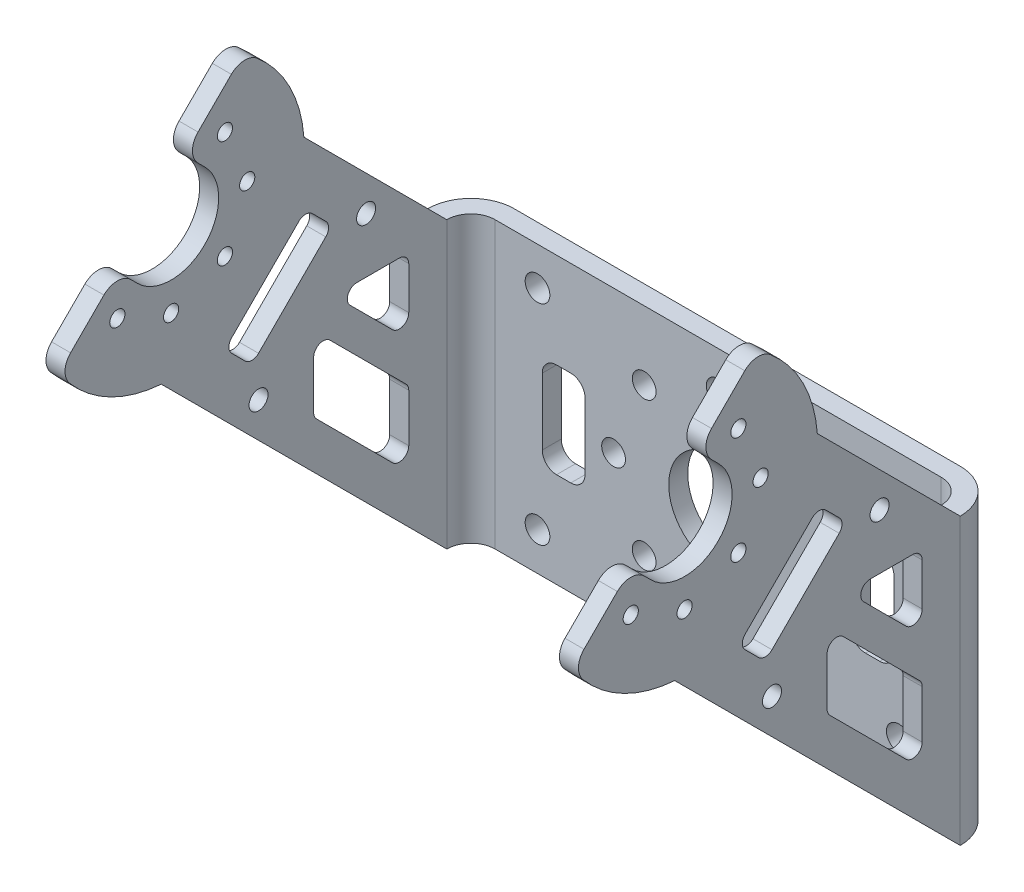
from build123d import *

# Parameters (mm, degrees)
KES_EKSTR_ZYON1_START          = -54
KES_EKSTR_ZYON1_OUTLINE_W      = 2
KES_EKSTR_ZYON1_OUTLINE_H      = 30
KES_EKSTR_ZYON1_DEPTH          = 56
KES_EKSTR_ZYON1_2_DEPTH        = 2
KES_EKSTR_ZYON1_3_DEPTH        = 2
KES_EKSTR_ZYON2_DEPTH          = 82.444892691
KES_EKSTR_ZYON3_DEPTH          = 82.444892691
KES_EKSTR_ZYON4_REACH          = 69.092
IZIM4_W                        = 4.5
IZIM4_H                        = 10
KES_EKSTR_ZYON5_DEPTH          = 82.444892691
KES_EKSTR_ZYON6_DEPTH          = 82.444892691
KES_EKSTR_ZYON7_DEPTH          = 82.444892691
KES_EKSTR_ZYON8_DEPTH          = 82.444892691
KES_EKSTR_ZYON9_DEPTH          = 82.444892691
KES_EKSTR_ZYON10_DEPTH         = 82.444892691
IZIM11_W                       = 4.5
IZIM11_H                       = 10
KES_EKSTR_ZYON11_DEPTH         = 66.75699783
DELIK1_D                       = 2.6
DELIK2_D                       = 10.4
F_0_2_0_2_DIAMETER_HOLE1_D     = 2
F_0_2_0_2_DIAMETER_HOLE1_DEPTH = 2
F_0_2_0_2_DIAMETER_HOLE2_D     = 2
RADYUS1_R                      = 1
RADYUS2_R                      = 1.5
RADYUS3_R                      = 2
RADYUS4_R                      = 2.54
RADYUS5_R                      = 4.54
IZIM24_R                       = 13.505605706
IZIM24_R_2                     = 7.578470051
Y_KSEKLIK_EKSTR_ZYON1_DEPTH    = 2
IZIM25_R                       = 1.25
KES_EKSTR_ZYON12_DEPTH         = 2
KES_EKSTR_ZYON13_REACH         = 84.134
IZIM27_R                       = 0.8


with BuildPart() as part:
    # Kes-Ekstrüzyon1: read off the stored shape, not the designer's step
    # Kes-Ekstrüzyon1 outline → Kes-Ekstrüzyon1 (new body)
    with BuildSketch(Plane(origin=(26, 0, 0), x_dir=(0, 0, -1), z_dir=(1, 0, 0)).offset(KES_EKSTR_ZYON1_START)):
        with Locations((-1, 0)):
            Rectangle(KES_EKSTR_ZYON1_OUTLINE_W, KES_EKSTR_ZYON1_OUTLINE_H)
    extrude(amount=KES_EKSTR_ZYON1_DEPTH)

    # Kes-Ekstr_zyon1 2 outline → Kes-Ekstr_zyon1 2 (add)
    with BuildSketch(Plane(origin=(26, 0, 0), x_dir=(0, 0, -1), z_dir=(1, 0, 0)).offset(KES_EKSTR_ZYON1_START)):
        with BuildLine():
            Line((-4.54, 15), (-19.569954037, 30.029954037))
            ThreePointArc((-19.569954037, 30.029954037), (-21.507688424, 36.162918334), (-25.983160829, 40.78224863))
            Line((-25.983160829, 40.78224863), (-45.321945481, 21.443463382))
            ThreePointArc((-45.321945481, 21.443463382), (-40.702951136, 16.968195195), (-34.570405924, 15.030406939))
            Line((-34.570405924, 15.030406939), (-4.54, -15))
            Line((-4.54, -15), (-2, -15))
            Line((-2, -15), (-2, 15))
            Line((-2, 15), (-4.54, 15))
        make_face()
    extrude(amount=KES_EKSTR_ZYON1_2_DEPTH)

    # Kes-Ekstr_zyon1 3 outline → Kes-Ekstr_zyon1 3 (add)
    with BuildSketch(Plane(origin=(26, 0, 0), x_dir=(0, 0, -1), z_dir=(1, 0, 0))):
        with BuildLine():
            Line((-4.54, 15), (-19.569954037, 30.029954037))
            ThreePointArc((-19.569954037, 30.029954037), (-21.507688424, 36.162918334), (-25.983160829, 40.78224863))
            Line((-25.983160829, 40.78224863), (-45.321945481, 21.443463382))
            ThreePointArc((-45.321945481, 21.443463382), (-40.702951136, 16.968195195), (-34.570405924, 15.030406939))
            Line((-34.570405924, 15.030406939), (-4.54, -15))
            Line((-4.54, -15), (-2, -15))
            Line((-2, -15), (-2, 15))
            Line((-2, 15), (-4.54, 15))
        make_face()
    extrude(amount=KES_EKSTR_ZYON1_3_DEPTH)

    # Çizim2 → Kes-Ekstrüzyon2 (cut, through all)
    with BuildSketch(Plane.ZY.offset(-26)):
        with BuildLine():
            Line((39.188241686, 27.577167772), (32.117166758, 34.648242701))
            Line((32.117166758, 34.648242701), (29.995846117, 32.52692206))
            ThreePointArc((29.995846117, 32.52692206), (29.995846117, 25.455847131), (37.066921045, 25.455847131))
            Line((37.066921045, 25.455847131), (39.188241686, 27.577167772))
        make_face()
    extrude(amount=-KES_EKSTR_ZYON2_DEPTH, mode=Mode.SUBTRACT)

    # Çizim3 → Kes-Ekstrüzyon3 (cut, through all)
    with BuildSketch(Plane(origin=(-26, 0, 0), x_dir=(0, 0, -1), z_dir=(1, 0, 0))):
        with BuildLine():
            Line((-32.11716646, 34.648242403), (-39.188241389, 27.577167475))
            Line((-39.188241389, 27.577167475), (-37.066921045, 25.455847131))
            ThreePointArc((-37.066921045, 25.455847131), (-29.995846117, 25.455847131), (-29.995846117, 32.52692206))
            Line((-29.995846117, 32.52692206), (-32.11716646, 34.648242403))
        make_face()
    extrude(amount=-KES_EKSTR_ZYON3_DEPTH, mode=Mode.SUBTRACT)

    # Çizim4 → Kes-Ekstrüzyon4 (cut, up to next)
    with BuildSketch(Plane(origin=(0, 0, 0), x_dir=(-1, 0, 0), z_dir=(0, 0, -1)), mode=Mode.PRIVATE) as kes_ekstr_zyon4_sk1:
        with Locations((16.25, 0)):
            Rectangle(IZIM4_W, IZIM4_H)
    kes_ekstr_zyon4_tool1 = extrude(kes_ekstr_zyon4_sk1.sketch, amount=-KES_EKSTR_ZYON4_REACH, mode=Mode.PRIVATE) & part.part
    add(kes_ekstr_zyon4_tool1.solids().sort_by_distance((-16.25, 0, 0))[0], mode=Mode.SUBTRACT)

    # Çizim5 → Kes-Ekstrüzyon5 (cut, through all)
    with BuildSketch(Plane.ZY.offset(-26)):
        with BuildLine():
            Line((10.247106781, 7.828427125), (14.711572875, 12.292893219))
            ThreePointArc((14.711572875, 12.292893219), (14.928345627, 13.382683432), (14.004466094, 14))
            Line((14.004466094, 14), (8.54, 14))
            Line((8.54, 14), (8.54, 8.535533906))
            ThreePointArc((8.54, 8.535533906), (9.157316568, 7.611654373), (10.247106781, 7.828427125))
        make_face()
    extrude(amount=-KES_EKSTR_ZYON5_DEPTH, mode=Mode.SUBTRACT)

    # Çizim6 → Kes-Ekstrüzyon6 (cut, through all)
    with BuildSketch(Plane.ZY.offset(-26)):
        Polygon((27.874529335, 14.849248859), (19.389247817, 23.334530089), (16.56082074, 20.506102917), (25.046102258, 12.020821686), align=None)
    extrude(amount=-KES_EKSTR_ZYON6_DEPTH, mode=Mode.SUBTRACT)

    # Çizim7 → Kes-Ekstrüzyon7 (cut, through all)
    with BuildSketch(Plane.ZY.offset(-26)):
        with BuildLine():
            Line((16.832893122, 10.171572778), (8.54, 1.878679656))
            Line((8.54, 1.878679656), (8.54, -3.585786438))
            ThreePointArc((8.54, -3.585786438), (9.157316575, -4.509665973), (10.247106793, -4.292893207))
            Line((10.247106793, -4.292893207), (18.539999854, 4.000000134))
            Line((18.539999854, 4.000000134), (18.539999854, 9.464466017))
            ThreePointArc((18.539999854, 9.464466017), (17.922683304, 10.388345523), (16.832893122, 10.171572778))
        make_face()
    extrude(amount=-KES_EKSTR_ZYON7_DEPTH, mode=Mode.SUBTRACT)

    # Çizim8 → Kes-Ekstrüzyon8 (cut, through all)
    with BuildSketch(Plane(origin=(-26, 0, 0), x_dir=(0, 0, -1), z_dir=(1, 0, 0))):
        with BuildLine():
            Line((-8.54, 8.535533906), (-8.54, 14))
            Line((-8.54, 14), (-14.004466094, 14))
            ThreePointArc((-14.004466094, 14), (-14.928345627, 13.382683432), (-14.711572875, 12.292893219))
            Line((-14.711572875, 12.292893219), (-10.247106781, 7.828427125))
            ThreePointArc((-10.247106781, 7.828427125), (-9.157316568, 7.611654373), (-8.54, 8.535533906))
        make_face()
    extrude(amount=-KES_EKSTR_ZYON8_DEPTH, mode=Mode.SUBTRACT)

    # Çizim9 → Kes-Ekstrüzyon9 (cut, through all)
    with BuildSketch(Plane(origin=(-26, 0, 0), x_dir=(0, 0, -1), z_dir=(1, 0, 0))):
        Polygon((-19.389247817, 23.334530089), (-27.874529335, 14.849248859), (-25.046102258, 12.020821686), (-16.56082074, 20.506102917), align=None)
    extrude(amount=-KES_EKSTR_ZYON9_DEPTH, mode=Mode.SUBTRACT)

    # Çizim10 → Kes-Ekstrüzyon10 (cut, through all)
    with BuildSketch(Plane(origin=(-26, 0, 0), x_dir=(0, 0, -1), z_dir=(1, 0, 0))):
        with BuildLine():
            Line((-18.539999854, 9.46446608), (-18.539999854, 4.000000134))
            Line((-18.539999854, 4.000000134), (-10.247106757, -4.292893243))
            ThreePointArc((-10.247106757, -4.292893243), (-9.157316576, -4.509666002), (-8.540000021, -3.585786497))
            Line((-8.540000021, -3.585786497), (-8.540000021, 1.878679489))
            Line((-8.540000021, 1.878679489), (-16.83289312, 10.171572827))
            ThreePointArc((-16.83289312, 10.171572827), (-17.9226833, 10.388345584), (-18.539999854, 9.46446608))
        make_face()
    extrude(amount=-KES_EKSTR_ZYON10_DEPTH, mode=Mode.SUBTRACT)

    # Çizim11 → Kes-Ekstrüzyon11 (cut, through all)
    with BuildSketch(Plane.XY.offset(2)):
        with Locations((16.25, 0)):
            Rectangle(IZIM11_W, IZIM11_H)
    extrude(amount=-KES_EKSTR_ZYON11_DEPTH, mode=Mode.SUBTRACT)

    # Delik1 (through all)
    with Locations(Plane.XY.offset(2)):
        with Locations((-19, 11), (19, 11), (-19, -11), (19, -11), (7.778174593, 7.778174593), (11, 0), (7.778174593, -7.778174593), (0, -11), (-7.778174593, -7.778174593), (-11, 0), (-7.778174593, 7.778174593), (0, 11)):
            Hole(DELIK1_D / 2)

    # Delik2 (through all)
    with Locations(Plane.XY.offset(2)):
        with Locations((0, 0)):
            Hole(DELIK2_D / 2)

    # Ø0.2 (0.2) Diameter Hole1
    with Locations(Plane.ZY.offset(28)):
        with Locations((24.338989873, 8.485281374), (13.025281374, 19.798989873)):
            Hole(F_0_2_0_2_DIAMETER_HOLE1_D / 2, depth=F_0_2_0_2_DIAMETER_HOLE1_DEPTH)

    # Ø0.2 (0.2) Diameter Hole2 (through all)
    with Locations(Plane.ZY.offset(-26)):
        with Locations((24.338989873, 8.485281374), (13.025281374, 19.798989873)):
            Hole(F_0_2_0_2_DIAMETER_HOLE2_D / 2)

    # Radyus1
    radyus1_edges = [part.edges().sort_by_distance(p)[0] for p in [
        (27, 14, 8.54),
        (27, 14.849248859, 27.874529335),
        (27, 12.020821686, 25.046102258),
        (27, 20.506102917, 16.56082074),
        (27, 23.334530089, 19.389247817),
        (27, 4.000000134, 18.539999854),
        (27, 1.878679656, 8.54),
        (-27, 14, 8.54),
        (-27, 23.334530089, 19.389247817),
        (-27, 20.506102917, 16.56082074),
        (-27, 12.020821686, 25.046102258),
        (-27, 14.849248859, 27.874529335),
        (-27, 1.878679489, 8.540000021),
        (-27, 4.000000134, 18.539999854),
    ]]
    fillet(radyus1_edges, radius=RADYUS1_R)

    # Radyus2
    radyus2_edges = [part.edges().sort_by_distance(p)[0] for p in [
        (-14, 5, 1),
        (-18.5, 5, 1),
        (-18.5, -5, 1),
        (-14, -5, 1),
        (18.5, -5, 1),
        (14, -5, 1),
        (14, 5, 1),
        (18.5, 5, 1),
    ]]
    fillet(radyus2_edges, radius=RADYUS2_R)

    # Radyus3
    radyus3_edges = [part.edges().sort_by_distance(p)[0] for p in [
        (27, 21.443463382, 45.321945481),
        (-27, 40.78224863, 25.983160829),
        (-27, 21.443463382, 45.321945481),
        (27, 40.78224863, 25.983160829),
        (27, 27.577167772, 39.188241686),
        (27, 34.648242701, 32.117166758),
        (-27, 34.648242403, 32.11716646),
        (-27, 27.577167475, 39.188241389),
    ]]
    fillet(radyus3_edges, radius=RADYUS3_R)

    # Radyus4
    radyus4_edges = [part.edges().sort_by_distance(p)[0] for p in [
        (-26, 0, 2),
        (26, 0, 2),
    ]]
    fillet(radyus4_edges, radius=RADYUS4_R)

    # Radyus5
    radyus5_edges = [part.edges().sort_by_distance(p)[0] for p in [
        (-28, 0, 0),
        (28, 0, 0),
    ]]
    fillet(radyus5_edges, radius=RADYUS5_R)

    # Çizim24 → Yükseklik-Ekstrüzyon1 (add)
    with BuildSketch(Plane.XY.offset(2)):
        Circle(IZIM24_R)
        Circle(IZIM24_R_2, mode=Mode.SUBTRACT)
    extrude(amount=-Y_KSEKLIK_EKSTR_ZYON1_DEPTH)

    # Çizim25 → Kes-Ekstrüzyon12 (cut)
    with BuildSketch(Plane.XY.offset(2)):
        with Locations((0, 11)):
            Circle(IZIM25_R)
        with Locations((7.778174593, 7.778174593)):
            Circle(IZIM25_R)
        with Locations((11, 0)):
            Circle(IZIM25_R)
        with Locations((7.778174593, -7.778174593)):
            Circle(IZIM25_R)
        with Locations((0, -11)):
            Circle(IZIM25_R)
        with Locations((-7.778174593, -7.778174593)):
            Circle(IZIM25_R)
        with Locations((-11, 0)):
            Circle(IZIM25_R)
        with Locations((-7.778174593, 7.778174593)):
            Circle(IZIM25_R)
    extrude(amount=-KES_EKSTR_ZYON12_DEPTH, mode=Mode.SUBTRACT)

    # Kes-Ekstrüzyon13: up to this face of the body (flat: up to its plane)
    kes_ekstr_zyon13_end = Plane(part.part.faces().sort_by_distance((28, 15.486105726, 21.072998549))[0])
    # Çizim27 → Kes-Ekstrüzyon13 (cut, up to the picked face)
    with BuildSketch(Plane.ZY.offset(28), mode=Mode.PRIVATE) as kes_ekstr_zyon13_sk1:
        with Locations((39.18823783, 23.334530346)):
            Circle(IZIM27_R)
    kes_ekstr_zyon13_tool1 = split(extrude(kes_ekstr_zyon13_sk1.sketch, amount=-KES_EKSTR_ZYON13_REACH, mode=Mode.PRIVATE), bisect_by=kes_ekstr_zyon13_end, keep=Keep.BOTH, mode=Mode.PRIVATE)
    # Çizim27 → Kes-Ekstrüzyon13 (cut, up to the picked face)
    with BuildSketch(Plane.ZY.offset(28), mode=Mode.PRIVATE) as kes_ekstr_zyon13_sk2:
        with Locations((33.531383581, 20.991384595)):
            Circle(IZIM27_R)
    kes_ekstr_zyon13_tool2 = split(extrude(kes_ekstr_zyon13_sk2.sketch, amount=-KES_EKSTR_ZYON13_REACH, mode=Mode.PRIVATE), bisect_by=kes_ekstr_zyon13_end, keep=Keep.BOTH, mode=Mode.PRIVATE)
    # Çizim27 → Kes-Ekstrüzyon13 (cut, up to the picked face)
    with BuildSketch(Plane.ZY.offset(28), mode=Mode.PRIVATE) as kes_ekstr_zyon13_sk3:
        with Locations((27.874529331, 23.334530346)):
            Circle(IZIM27_R)
    kes_ekstr_zyon13_tool3 = split(extrude(kes_ekstr_zyon13_sk3.sketch, amount=-KES_EKSTR_ZYON13_REACH, mode=Mode.PRIVATE), bisect_by=kes_ekstr_zyon13_end, keep=Keep.BOTH, mode=Mode.PRIVATE)
    # Çizim27 → Kes-Ekstrüzyon13 (cut, up to the picked face)
    with BuildSketch(Plane.ZY.offset(28), mode=Mode.PRIVATE) as kes_ekstr_zyon13_sk4:
        with Locations((25.531383581, 28.991384595)):
            Circle(IZIM27_R)
    kes_ekstr_zyon13_tool4 = split(extrude(kes_ekstr_zyon13_sk4.sketch, amount=-KES_EKSTR_ZYON13_REACH, mode=Mode.PRIVATE), bisect_by=kes_ekstr_zyon13_end, keep=Keep.BOTH, mode=Mode.PRIVATE)
    # Çizim27 → Kes-Ekstrüzyon13 (cut, up to the picked face)
    with BuildSketch(Plane.ZY.offset(28), mode=Mode.PRIVATE) as kes_ekstr_zyon13_sk5:
        with Locations((27.874529331, 34.648238845)):
            Circle(IZIM27_R)
    kes_ekstr_zyon13_tool5 = split(extrude(kes_ekstr_zyon13_sk5.sketch, amount=-KES_EKSTR_ZYON13_REACH, mode=Mode.PRIVATE), bisect_by=kes_ekstr_zyon13_end, keep=Keep.BOTH, mode=Mode.PRIVATE)
    add(kes_ekstr_zyon13_tool1.solids().sort_by(Axis((-28, 23.33453, 39.188238), (1, 0, 0)))[0], mode=Mode.SUBTRACT)
    add(kes_ekstr_zyon13_tool2.solids().sort_by(Axis((-28, 20.991385, 33.531384), (1, 0, 0)))[0], mode=Mode.SUBTRACT)
    add(kes_ekstr_zyon13_tool3.solids().sort_by(Axis((-28, 23.33453, 27.874529), (1, 0, 0)))[0], mode=Mode.SUBTRACT)
    add(kes_ekstr_zyon13_tool4.solids().sort_by(Axis((-28, 28.991385, 25.531384), (1, 0, 0)))[0], mode=Mode.SUBTRACT)
    add(kes_ekstr_zyon13_tool5.solids().sort_by(Axis((-28, 34.648239, 27.874529), (1, 0, 0)))[0], mode=Mode.SUBTRACT)


solid = part.part
